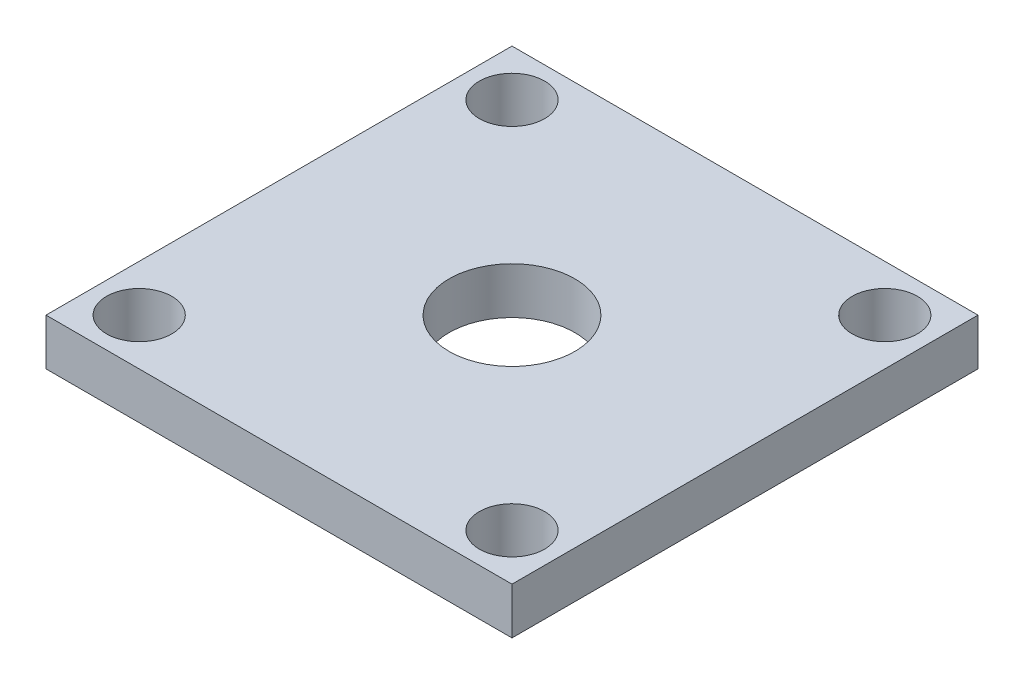
from build123d import *

# Parameters (mm, degrees)
SKETCH_1_W      = 10
SKETCH_1_H      = 10
SKETCH_1_R      = 0.7
SKETCH_1_R_2    = 1.35
EXTRUDE_1_DEPTH = 1


with BuildPart() as part:
    # 草图1 → 凸台-拉伸1 (new body)
    with BuildSketch(Plane(origin=(0, 0, 0), x_dir=(1, 0, 0), z_dir=(0, 1, 0))):
        Rectangle(SKETCH_1_W, SKETCH_1_H)
        with Locations((4, -4)):
            Circle(SKETCH_1_R, mode=Mode.SUBTRACT)
        with Locations((-4, 4)):
            Circle(SKETCH_1_R, mode=Mode.SUBTRACT)
        with Locations((4, 4)):
            Circle(SKETCH_1_R, mode=Mode.SUBTRACT)
        with Locations((-4, -4)):
            Circle(SKETCH_1_R, mode=Mode.SUBTRACT)
        Circle(SKETCH_1_R_2, mode=Mode.SUBTRACT)
    extrude(amount=EXTRUDE_1_DEPTH)


solid = part.part
